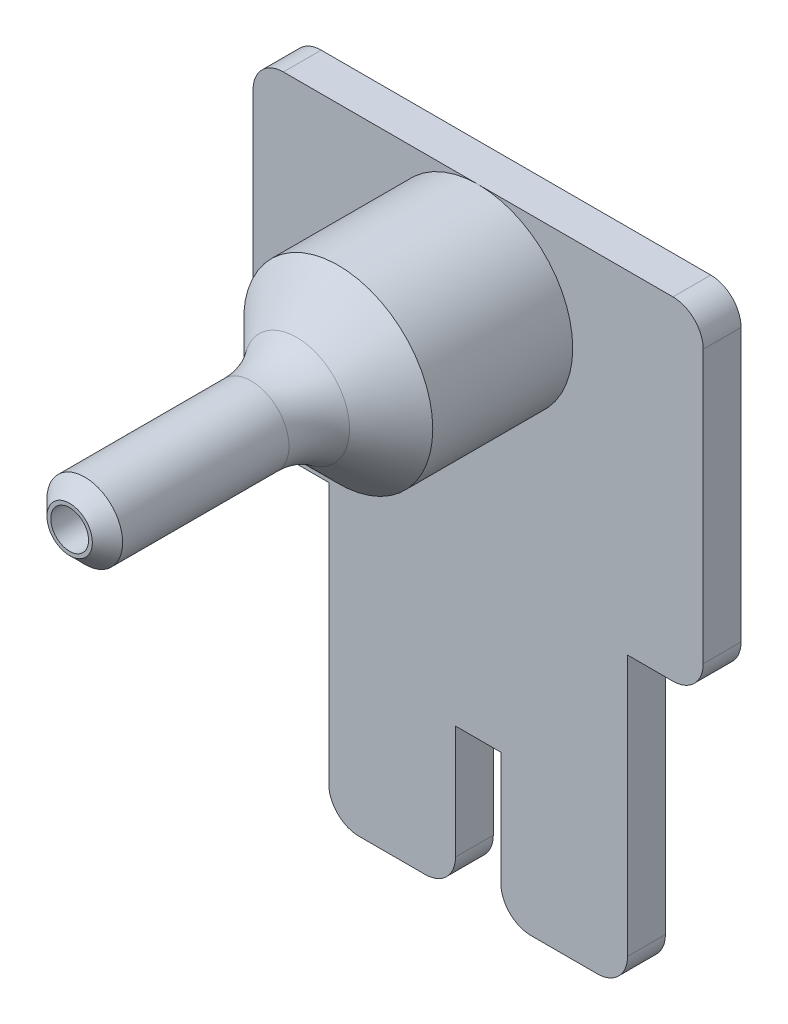
from build123d import *

# Parameters (mm, degrees)
CROQUIS1_W                          = 19.75
CROQUIS1_H                          = 35
SALIENTE_EXTRUIR1_DEPTH             = 2.5
CROQUIS2_W                          = 3
CROQUIS2_H                          = 9.5
CORTAR_EXTRUIR1_DEPTH               = 21.24884256
CROQUIS3_W                          = 29.75
CROQUIS3_H                          = 15.75
SALIENTE_EXTRUIR2_DEPTH             = 2.5
CROQUIS7_R                          = 6.25
SALIENTE_EXTRUIR4_DEPTH             = 12
SALIENTE_EXTRUIR4_DIRECTION_2_REACH = 25.103
CROQUIS4_R                          = 2.5
SALIENTE_EXTRUIR3_DEPTH             = 15
CROQUIS5_R                          = 1.25
CORTAR_EXTRUIR2_DEPTH               = 41.688796062
CROQUIS10_R                         = 4.125
CORTAR_EXTRUIR3_DEPTH               = 12
CHAFL_N1_SIZE                       = 1
REDONDEO1_R                         = 2
CHAFL_N2_SIZE                       = 2.75
REDONDEO2_R                         = 5
SALIENTE_EXTRUIR5_DEPTH             = 2.5


with BuildPart() as part:
    # Croquis1 → Saliente-Extruir1 (new body)
    with BuildSketch(Plane.XY):
        Rectangle(CROQUIS1_W, CROQUIS1_H)
    extrude(amount=SALIENTE_EXTRUIR1_DEPTH)

    # Croquis2 → Cortar-Extruir1 (cut, through all)
    with BuildSketch(Plane.XY.offset(2.5)):
        with Locations((0, -12.75)):
            Rectangle(CROQUIS2_W, CROQUIS2_H)
    extrude(amount=-CORTAR_EXTRUIR1_DEPTH, mode=Mode.SUBTRACT)

    # Croquis3 → Saliente-Extruir2 (add, through all)
    with BuildSketch(Plane.XY.offset(2.5)):
        with Locations((0, 9.625)):
            Rectangle(CROQUIS3_W, CROQUIS3_H)
    extrude(amount=-SALIENTE_EXTRUIR2_DEPTH)

    # Croquis7 → Saliente-Extruir4 (add)
    with BuildSketch(Plane.XY.offset(2.5)):
        with Locations((0, 17.5)):
            Circle(CROQUIS7_R)
    extrude(amount=SALIENTE_EXTRUIR4_DEPTH)

    # Saliente-Extruir4 direction 2: up to this face of the body (flat: up to its plane)
    saliente_extruir4_direction_2_end = Plane(part.part.faces().sort_by_distance((0, 2.291145992, 0))[0])
    # Croquis7 → Saliente-Extruir4 direction 2 (add, up to the picked face)
    with BuildSketch(Plane.XY.offset(2.5), mode=Mode.PRIVATE) as saliente_extruir4_direction_2_sk1:
        with Locations((0, 17.5)):
            Circle(CROQUIS7_R)
    saliente_extruir4_direction_2_tool1 = split(extrude(saliente_extruir4_direction_2_sk1.sketch, amount=-SALIENTE_EXTRUIR4_DIRECTION_2_REACH, mode=Mode.PRIVATE), bisect_by=saliente_extruir4_direction_2_end, keep=Keep.BOTH, mode=Mode.PRIVATE)
    add(saliente_extruir4_direction_2_tool1.solids().sort_by(Axis((0, 17.5, 2.5), (0, 0, -1)))[0])

    # Croquis4 → Saliente-Extruir3 (add)
    with BuildSketch(Plane.XY.offset(14.5)):
        with Locations((0, 17.5)):
            Circle(CROQUIS4_R)
    extrude(amount=SALIENTE_EXTRUIR3_DEPTH)

    # Croquis5 → Cortar-Extruir2 (cut, through all)
    with BuildSketch(Plane.XY.offset(29.5)):
        with Locations((0, 17.5)):
            Circle(CROQUIS5_R)
    extrude(amount=-CORTAR_EXTRUIR2_DEPTH, mode=Mode.SUBTRACT)

    # Croquis10 → Cortar-Extruir3 (cut)
    with BuildSketch(Plane(origin=(0, 0, 0), x_dir=(-1, 0, 0), z_dir=(0, 0, -1))):
        with Locations((0, 17.5)):
            Circle(CROQUIS10_R)
    extrude(amount=-CORTAR_EXTRUIR3_DEPTH, mode=Mode.SUBTRACT)

    # Chaflán1
    chafl_n1_edges = [part.edges().sort_by_distance(p)[0] for p in [
        (-2.5, 17.5, 29.5),
        (4.125, 17.5, 0),
    ]]
    chamfer(chafl_n1_edges, length=CHAFL_N1_SIZE)

    # Redondeo1
    redondeo1_edges = [part.edges().sort_by_distance(p)[0] for p in [
        (1.5, -17.5, 1.25),
        (-1.5, -17.5, 1.25),
        (-14.875, 17.5, 1.25),
        (14.875, 1.75, 1.25),
        (-14.875, 1.75, 1.25),
        (14.875, 17.5, 1.25),
        (9.875, -17.5, 1.25),
        (-9.875, -17.5, 1.25),
    ]]
    fillet(redondeo1_edges, radius=REDONDEO1_R)

    # Chaflán2
    chafl_n2_edges = [part.edges().sort_by_distance(p)[0] for p in [
        (-6.25, 17.5, 14.5),
        (4.125, 17.5, 12),
    ]]
    chamfer(chafl_n2_edges, length=CHAFL_N2_SIZE)

    # Redondeo2
    # the kernel refuses this fillet: 5 mm, written as the material it adds along each edge
    with BuildSketch(Plane(origin=(0, 17.5, 14.5), x_dir=(1, 0, 0), z_dir=(0, -1, 0))) as redondeo2_piece_1:
        with BuildLine():
            CenterArc((7.5, 3), REDONDEO2_R, 180, 36.869897646)
            Line((2.5, 3), (2.4, 3))
            Line((2.4, 3), (2.4, 0))
            Line((2.4, 0), (2.5, -0.1))
            ThreePointArc((2.5, -0.1), (3, -0.1), (3.42, -0.06))
            Line((3.42, -0.06), (3.5, 0))
        make_face()
    revolve(axis=Axis((0, 17.5, 14.5), (0, 0, 1)))

    # Croquis11 → Saliente-Extruir5 (add)
    with BuildSketch(Plane(origin=(0, 0, 0), x_dir=(-1, 0, 0), z_dir=(0, 0, -1))):
        with BuildLine():
            ThreePointArc((-6.25, 17.5), (-4.419417386, 21.919417379), (-1e-08, 23.75))
            Line((-1e-08, 23.75), (-12.875, 23.75))
            ThreePointArc((-12.875, 23.75), (-14.289213562, 23.164213562), (-14.875, 21.75))
            Line((-14.875, 21.75), (-14.875, 15.5))
            ThreePointArc((-14.875, 15.5), (-14.289213562, 16.914213562), (-12.875, 17.5))
            Line((-12.875, 17.5), (-6.25, 17.5))
        make_face()
        with BuildLine():
            ThreePointArc((-1e-08, 23.75), (4.419417379, 21.919417386), (6.25, 17.5))
            Line((6.25, 17.5), (12.875, 17.5))
            ThreePointArc((12.875, 17.5), (14.289213562, 16.914213562), (14.875, 15.5))
            Line((14.875, 15.5), (14.875, 21.75))
            ThreePointArc((14.875, 21.75), (14.289213562, 23.164213562), (12.875, 23.75))
            Line((12.875, 23.75), (-1e-08, 23.75))
        make_face()
    extrude(amount=-SALIENTE_EXTRUIR5_DEPTH)


solid = part.part
